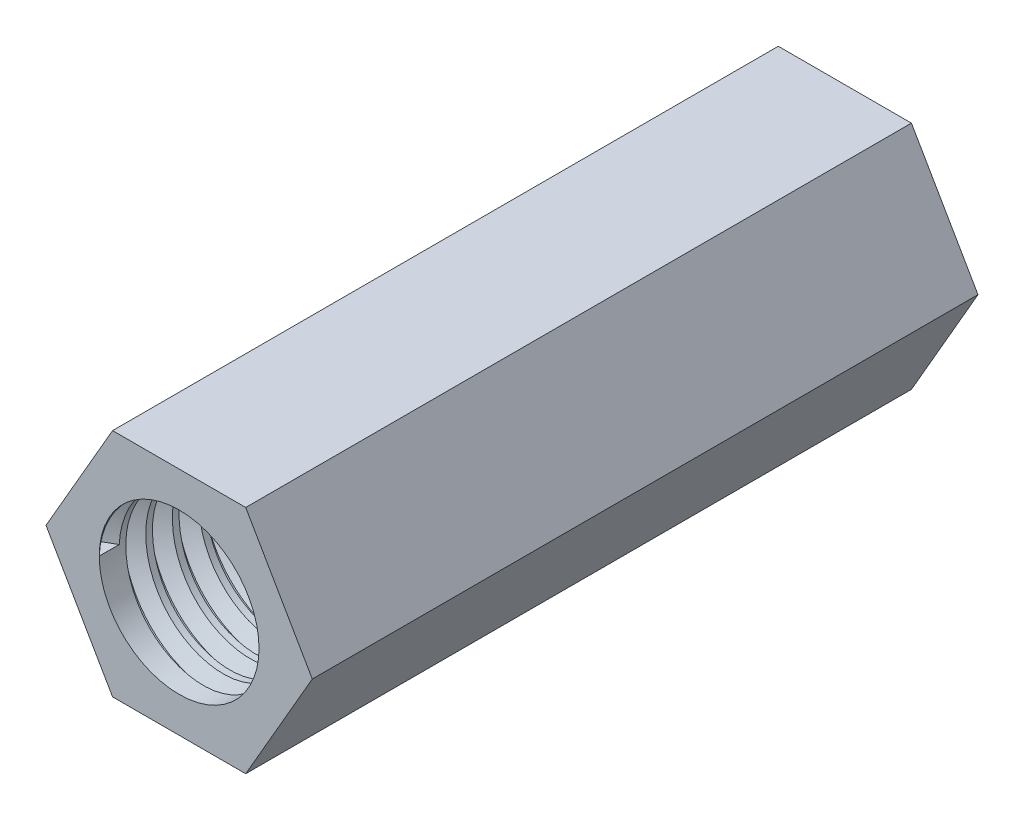
from build123d import *

# Parameters (mm, degrees)
BOSS_EXTRU_1_DEPTH   = 10
D_GAGEMENT_M21_D     = 2.4
D_GAGEMENT_M21_DEPTH = 4
D_GAGEMENT_M21_TIP   = 0.721032743
FILETAGE1_PITCH      = 0.4
D_GAGEMENT_M22_D     = 2.4
D_GAGEMENT_M22_DEPTH = 4
D_GAGEMENT_M22_TIP   = 0.721032743
FILETAGE2_PITCH      = 0.4


with BuildPart() as part:
    # Esquisse1 → Boss.-Extru.1 (new body)
    with BuildSketch(Plane.XY):
        Polygon((3, 0.267949192), (4, 2), (3, 3.732050808), (1, 3.732050808), (0, 2), (1, 0.267949192), align=None)
    extrude(amount=BOSS_EXTRU_1_DEPTH)

    # Dégagement M21
    with Locations(Plane.XY.offset(10)):
        with Locations((2, 2)):
            Hole(D_GAGEMENT_M21_D / 2, depth=D_GAGEMENT_M21_DEPTH)
            with Locations((0, 0, -(D_GAGEMENT_M21_DEPTH + D_GAGEMENT_M21_TIP / 2))):  # 118° drill point
                Cone(0, D_GAGEMENT_M21_D / 2, D_GAGEMENT_M21_TIP, mode=Mode.SUBTRACT)

    # Filetage1: the profile of Profil de filetage1 profile screwed along a right-hand helix of 10 turns, 6 arcs to a turn; built about Z, then put on its axis
    filetage1_z = Axis((0, 0, 0), (0, 0, 1))
    filetage1_corners = [(1.1997, 0, -0.000173205), (1.41650635, 0, 0.124999999), (1.41650635, 0, 0.174999999), (1.1997, 0, 0.300173204)]
    with BuildLine(mode=Mode.PRIVATE) as filetage1_profile:
        Line(filetage1_corners[0], filetage1_corners[1])
        Line(filetage1_corners[1], filetage1_corners[2])
        Line(filetage1_corners[2], filetage1_corners[3])
        Line(filetage1_corners[3], filetage1_corners[0])
    filetage1_cap = Face(filetage1_profile.wire())
    filetage1_turn_angles = [0, 30, 60, 90, 120, 150, 180, 210, 240, 270, 300, 330, 360]
    filetage1_turn_weights = [1, 0.8660254037844387, 1, 0.8660254037844387, 1, 0.8660254037844387, 1, 0.8660254037844387, 1, 0.8660254037844387, 1, 0.8660254037844387, 1]
    filetage1_turn_rails = [Edge.make_bspline([Vector(p[0], p[1], 0).rotate(filetage1_z, filetage1_turn_angles[k]) / filetage1_turn_weights[k] + Vector(0, 0, p[2] + FILETAGE1_PITCH * filetage1_turn_angles[k] / 360) for k in range(13)], [0, 0, 0, 1, 1, 2, 2, 3, 3, 4, 4, 5, 5, 6, 6, 6], 2, filetage1_turn_weights) for p in filetage1_corners]
    filetage1_turn_sides = [Face.make_surface_from_curves(filetage1_turn_rails[p[0]], filetage1_turn_rails[p[1]]) for p in [(0, 1), (1, 2), (2, 3), (3, 0)]]
    filetage1 = Plane(origin=(2, 2, 10), x_dir=(-1, 0, 0), z_dir=(0, 0, -1)) * Solid(Shell([*[p.moved(Location((0, 0, FILETAGE1_PITCH * i))) for i in range(10) for p in filetage1_turn_sides], filetage1_cap, filetage1_cap.rotate(filetage1_z, 3600).moved(Location((0, 0, FILETAGE1_PITCH * 3600 / 360)))]))
    add(filetage1, mode=Mode.SUBTRACT)

    # Dégagement M22
    with Locations(Plane(origin=(0, 0, 0), x_dir=(-1, 0, 0), z_dir=(0, 0, -1))):
        with Locations((-2, 2)):
            Hole(D_GAGEMENT_M22_D / 2, depth=D_GAGEMENT_M22_DEPTH)
            with Locations((0, 0, -(D_GAGEMENT_M22_DEPTH + D_GAGEMENT_M22_TIP / 2))):  # 118° drill point
                Cone(0, D_GAGEMENT_M22_D / 2, D_GAGEMENT_M22_TIP, mode=Mode.SUBTRACT)

    # Filetage2: the profile of Profil de filetage2 profile screwed along a right-hand helix of 10 turns, 6 arcs to a turn; built about Z, then put on its axis
    filetage2_z = Axis((0, 0, 0), (0, 0, 1))
    filetage2_corners = [(1.1997, 0, -0.000173205), (1.41650635, 0, 0.124999999), (1.41650635, 0, 0.174999999), (1.1997, 0, 0.300173204)]
    with BuildLine(mode=Mode.PRIVATE) as filetage2_profile:
        Line(filetage2_corners[0], filetage2_corners[1])
        Line(filetage2_corners[1], filetage2_corners[2])
        Line(filetage2_corners[2], filetage2_corners[3])
        Line(filetage2_corners[3], filetage2_corners[0])
    filetage2_cap = Face(filetage2_profile.wire())
    filetage2_turn_angles = [0, 30, 60, 90, 120, 150, 180, 210, 240, 270, 300, 330, 360]
    filetage2_turn_weights = [1, 0.8660254037844387, 1, 0.8660254037844387, 1, 0.8660254037844387, 1, 0.8660254037844387, 1, 0.8660254037844387, 1, 0.8660254037844387, 1]
    filetage2_turn_rails = [Edge.make_bspline([Vector(p[0], p[1], 0).rotate(filetage2_z, filetage2_turn_angles[k]) / filetage2_turn_weights[k] + Vector(0, 0, p[2] + FILETAGE2_PITCH * filetage2_turn_angles[k] / 360) for k in range(13)], [0, 0, 0, 1, 1, 2, 2, 3, 3, 4, 4, 5, 5, 6, 6, 6], 2, filetage2_turn_weights) for p in filetage2_corners]
    filetage2_turn_sides = [Face.make_surface_from_curves(filetage2_turn_rails[p[0]], filetage2_turn_rails[p[1]]) for p in [(0, 1), (1, 2), (2, 3), (3, 0)]]
    filetage2 = Plane(origin=(2, 2, 0), x_dir=(1, 0, 0), z_dir=(0, 0, 1)) * Solid(Shell([*[p.moved(Location((0, 0, FILETAGE2_PITCH * i))) for i in range(10) for p in filetage2_turn_sides], filetage2_cap, filetage2_cap.rotate(filetage2_z, 3600).moved(Location((0, 0, FILETAGE2_PITCH * 3600 / 360)))]))
    add(filetage2, mode=Mode.SUBTRACT)


solid = part.part
